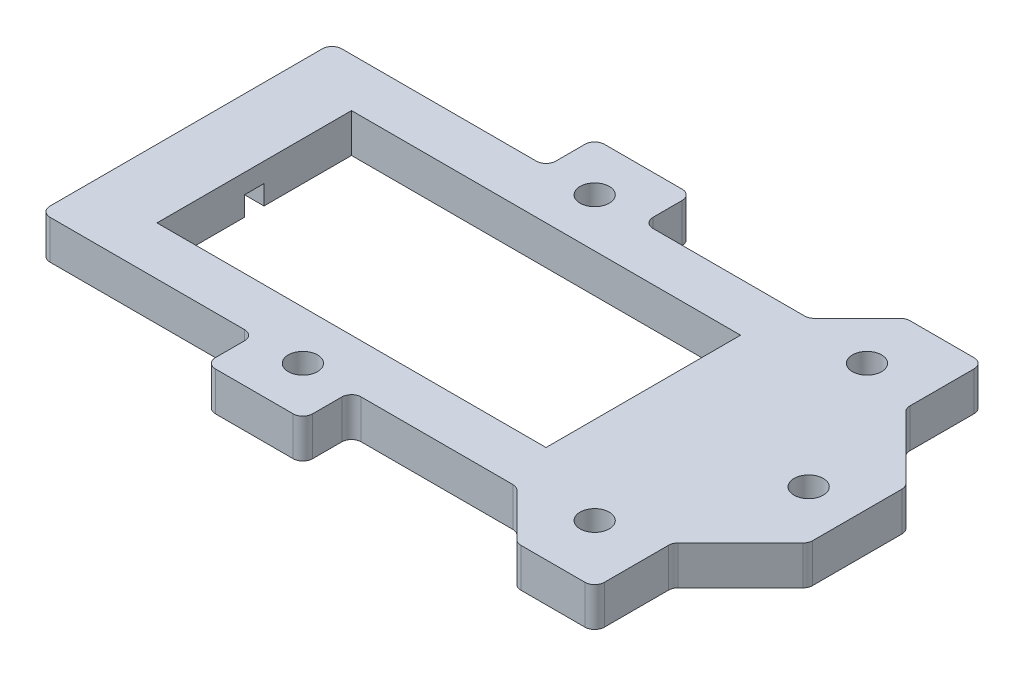
from build123d import *

# Parameters (mm, degrees)
EXTRUDE_1_OUTLINE_W = 40
EXTRUDE_1_OUTLINE_H = 20
EXTRUDE_1_DEPTH     = 4
SKETCH_2_R          = 1.5
CUT_EXTRUDE_1_DEPTH = 47.69047012
SKETCH_3_W          = 7
SKETCH_3_H          = 2
CUT_EXTRUDE_2_DEPTH = 2
FILLET_1_R          = 1


# Read off the part's stored shape, not the designer's step: 凸台-拉伸1
with BuildPart() as part:
    # 凸台-拉伸1 outline → 凸台-拉伸1 (new body)
    with BuildSketch(Plane(origin=(0, 0, 0), x_dir=(1, 0, 0), z_dir=(0, 1, 0))):
        Polygon((-27, -15), (-5, -15), (-5, -20), (5, -20), (5, -15), (22, -15), (27, -20), (35, -20), (35, -12), (42, -5), (42, 5), (35, 12), (35, 20), (27, 20), (22, 15), (5, 15), (5, 20), (-5, 20), (-5, 15), (-27, 15), align=None)
        Rectangle(EXTRUDE_1_OUTLINE_W, EXTRUDE_1_OUTLINE_H, mode=Mode.SUBTRACT)
    extrude(amount=EXTRUDE_1_DEPTH)

    # 草图2 → 切除-拉伸1 (cut, through all)
    with BuildSketch(Plane(origin=(0, 4, 0), x_dir=(1, 0, 0), z_dir=(0, 1, 0))):
        with Locations(Location((0, 15, 0), (0, 0, 270))):
            Circle(SKETCH_2_R)
        with Locations(Location((0, -15, 0), (0, 0, 90))):
            Circle(SKETCH_2_R)
        with Locations(Location((29, 14, 0), (0, 0, 270))):
            Circle(SKETCH_2_R)
        with Locations(Location((29, -14, 0), (0, 0, 90))):
            Circle(SKETCH_2_R)
        with Locations(Location((37, 0, 0), (0, 0, 270))):
            Circle(SKETCH_2_R)
    extrude(amount=-CUT_EXTRUDE_1_DEPTH, mode=Mode.SUBTRACT)

    # 草图3 → 切除-拉伸2 (cut)
    with BuildSketch(Plane.XZ):
        with Locations((-23.5, 0)):
            Rectangle(SKETCH_3_W, SKETCH_3_H)
        with Locations((23.5, 0)):
            Rectangle(SKETCH_3_W, SKETCH_3_H)
    extrude(amount=-CUT_EXTRUDE_2_DEPTH, mode=Mode.SUBTRACT)

    # 圆角1
    fillet_1_edges = [part.edges().sort_by_distance(p)[0] for p in [
        (-27, 2, 15),
        (-27, 2, -15),
        (-5, 2, -15),
        (-5, 2, -20),
        (5, 2, -20),
        (5, 2, -15),
        (22, 2, -15),
        (27, 2, -20),
        (35, 2, -20),
        (35, 2, -12),
        (42, 2, -5),
        (42, 2, 5),
        (35, 2, 12),
        (35, 2, 20),
        (27, 2, 20),
        (22, 2, 15),
        (5, 2, 15),
        (5, 2, 20),
        (-5, 2, 20),
        (-5, 2, 15),
    ]]
    fillet(fillet_1_edges, radius=FILLET_1_R)


solid = part.part
